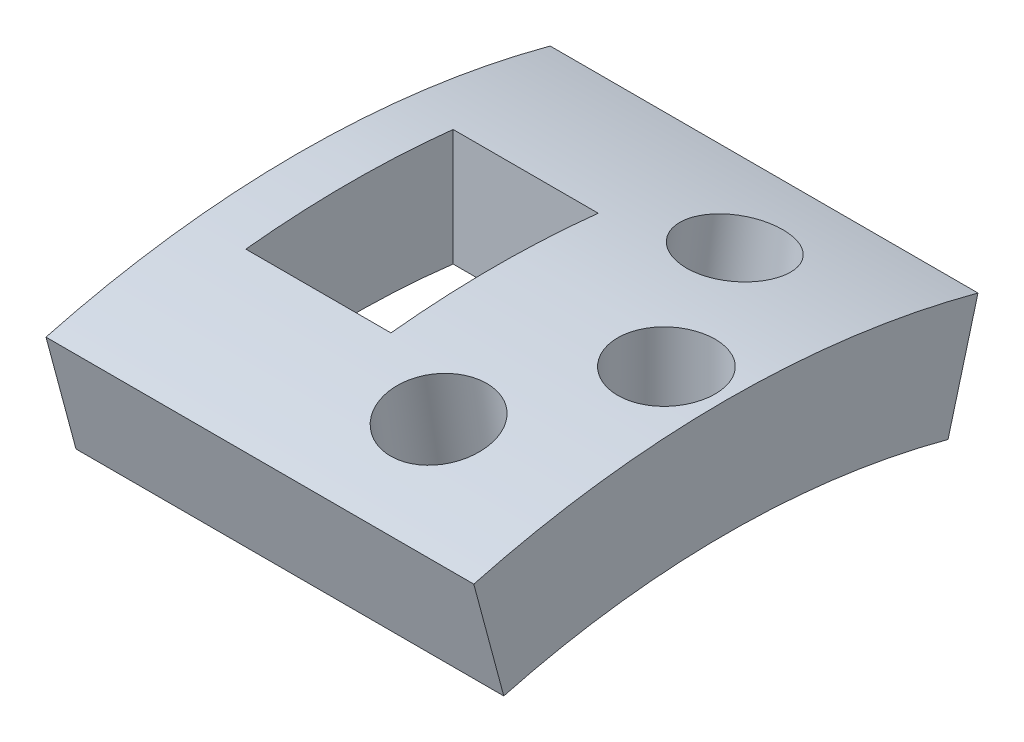
from build123d import *

# Parameters (mm, degrees)
SKETCH1_W          = 20.6375
SKETCH1_H          = 5.588
REVOLVE1_ANGLE     = 30
SKETCH2_W          = 6.99999997
SKETCH2_H          = 10.000000066
SKETCH2_R          = 2.349999999
CUT_EXTRUDE1_DEPTH = 18.417546569


with BuildPart() as part:
    # Sketch1 → Revolve1 (revolve, symmetric)
    with BuildSketch(Plane.XY) as revolve1_sk:
        with Locations((0, -2.794)):
            Rectangle(SKETCH1_W, SKETCH1_H)
    revolve(axis=Axis((21.580970856, -46.99, 0), (-1, 0, 0)), revolution_arc=REVOLVE1_ANGLE / 2)
    revolve(revolve1_sk.sketch, axis=Axis((21.580970856, -46.99, 0), (1, 0, 0)), revolution_arc=REVOLVE1_ANGLE / 2)

    # Sketch2 → Cut-Extrude1 (cut, through all)
    with BuildSketch(Plane(origin=(0, 0, 0), x_dir=(1, 0, 0), z_dir=(0, 1, 0))):
        with Locations((-4.341211084, 0)):
            Rectangle(SKETCH2_W, SKETCH2_H)
        with Locations((7.450199548, 0)):
            Circle(SKETCH2_R)
    extrude(amount=-CUT_EXTRUDE1_DEPTH, mode=Mode.SUBTRACT)

    # Sketch3 → Cut-Revolve1 (revolve, cut)
    with BuildSketch(Plane.ZY.offset(-3.603788901)):
        Polygon((5.781595888, -9.426368345), (8.104245437, -9.783858303), (9.777602661, 1.088118158), (7.454953113, 1.445608116), align=None)
    cut_revolve1 = revolve(axis=Axis((3.603788901, -46.99, 0), (0, 0.9883615104677607, 0.15212338618991705)), mode=Mode.SUBTRACT)

    # Mirror1: Cut-Revolve1 across plane
    add(cut_revolve1.mirror(Plane.XY), mode=Mode.SUBTRACT)


solid = part.part
